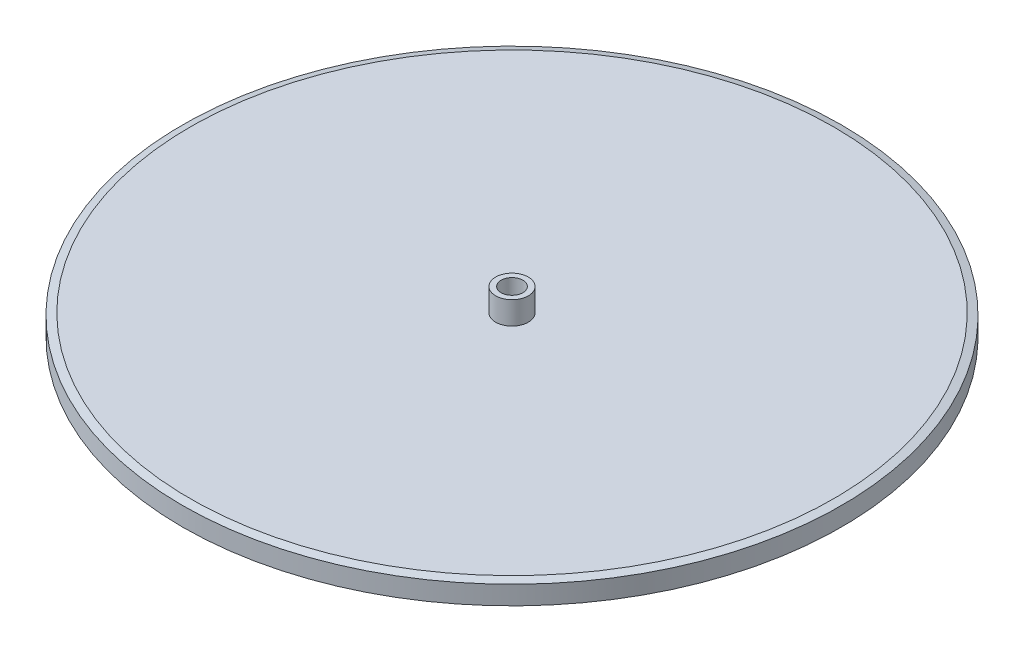
from build123d import *

# Parameters (mm, degrees)
CHAMFER_1_SIZE           = 1.41
CHAMFER_1_SIZE2          = 0.377808361
CHAMFER_2_SIZE           = 1.41
CHAMFER_2_SIZE2          = 0.377808361
CUT_EXTRUDE_3_DEPTH      = 87.112020067
CUT_EXTRUDE_3_DEPTH_BACK = 87.112020067
SKETCH_2_R               = 2


with BuildPart() as part:
    # Эскиз1 → Повернуть2 (revolve)
    with BuildSketch(Plane.XY):
        Polygon((0, 0), (60.6, 0), (60.6, 4.2), (3, 4.2), (3, 8.4), (0, 8.4), align=None)
    revolve(axis=Axis((0, 8.4, 0), (0, -1, 0)))

    # Фаска1
    chamfer_1_edges = [part.edges().sort_by_distance(p)[0] for p in [
        (-60.6, 4.2, 0),
    ]]
    chamfer_1_side = [part.faces().sort_by_distance(p)[0] for p in [
        (-58.885973162, 4.2, 0),
    ]]
    chamfer(chamfer_1_edges, length=CHAMFER_1_SIZE, length2=CHAMFER_1_SIZE2, reference=chamfer_1_side[0])

    # Фаска2
    chamfer_2_edges = [part.edges().sort_by_distance(p)[0] for p in [
        (-60.6, 0, 0),
    ]]
    chamfer_2_side = [part.faces().sort_by_distance(p)[0] for p in [
        (0, 0, 0),
    ]]
    chamfer(chamfer_2_edges, length=CHAMFER_2_SIZE, length2=CHAMFER_2_SIZE2, reference=chamfer_2_side[0])

    # Эскиз2 → Вырез-Вытянуть3 (cut, two sides: drawn at the far end of the back side and taken through both)
    with BuildSketch(Plane(origin=(0, 0, 0), x_dir=(-1, 0, 0), z_dir=(0, -1, 0)).offset(-CUT_EXTRUDE_3_DEPTH_BACK)):
        Circle(SKETCH_2_R)
    extrude(amount=CUT_EXTRUDE_3_DEPTH + CUT_EXTRUDE_3_DEPTH_BACK, mode=Mode.SUBTRACT)


solid = part.part
